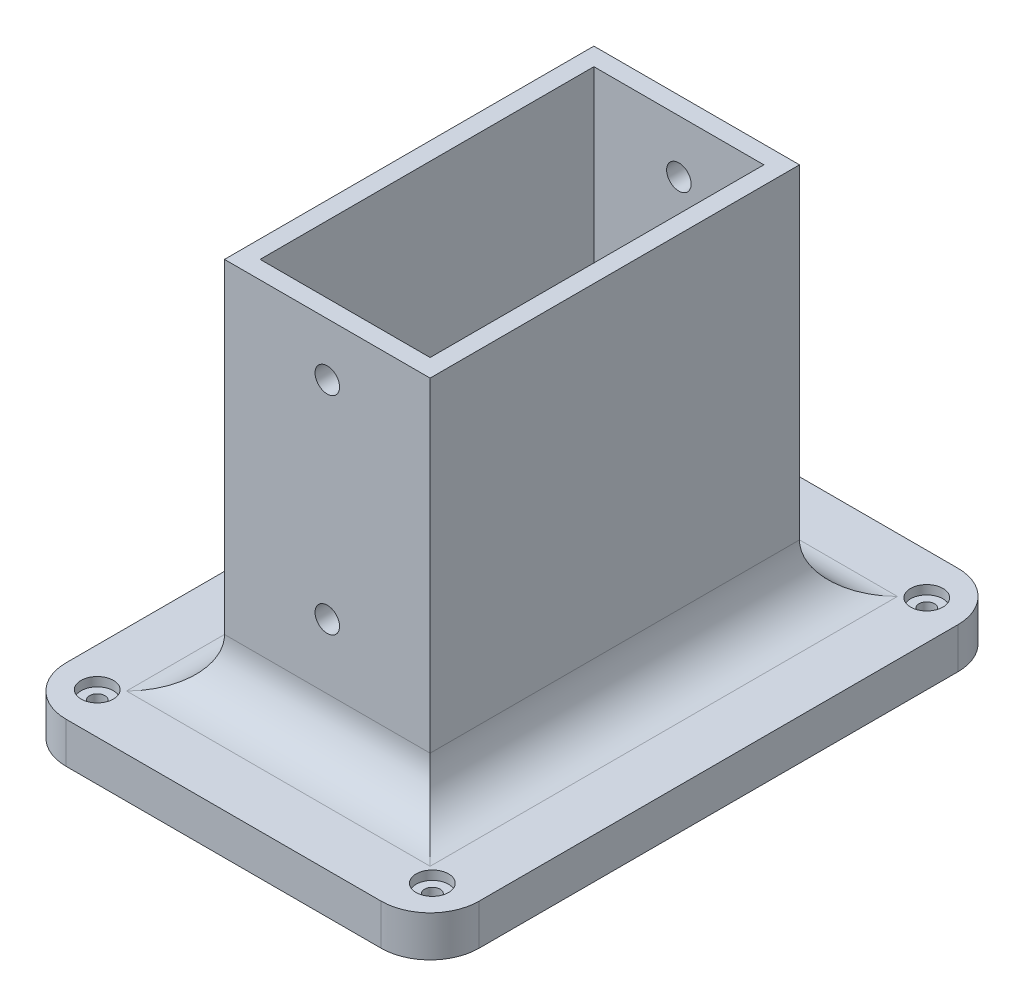
from build123d import *

# Parameters (mm, degrees)
SKETCH1_W                                     = 50.386
SKETCH1_H                                     = 90.518
SKETCH1_W_2                                   = 40.386
SKETCH1_H_2                                   = 80.518
BOSS_EXTRUDE1_DEPTH                           = 101.6
SKETCH2_W                                     = 101.186
SKETCH2_H                                     = 141.318
BOSS_EXTRUDE2_DEPTH                           = 10
FILLET1_R                                     = 12
CBORE_FOR_6_BINDING_HEAD_MACHINE_SC_2_R       = 1.89865
CBORE_FOR_6_BINDING_HEAD_MACHINE_SCREW2_DEPTH = 10
CBORE_START                                   = 7.7902
CBORE_FOR_6_BINDING_HEAD_MACHINE_SC_3_O_R     = 3.96875
CBORE_FOR_6_BINDING_HEAD_MACHINE_SC_3_O_R_2   = 1.89865
CBORE_FOR_6_BINDING_HEAD_MACHINE_SC_3_DEPTH   = 2.2098
FILLET2_R                                     = 12
SKETCH9_R                                     = 3
CUT_EXTRUDE1_DEPTH                            = 163.231915396
CUT_EXTRUDE2_REACH                            = 135.697
SKETCH10_W                                    = 41.656
SKETCH10_H                                    = 81.788
SKETCH10_W_2                                  = 40.386
SKETCH10_H_2                                  = 80.518
CUT_EXTRUDE2_DIRECTION_2_DEPTH                = 134.697067769


# Read off the part's stored shape, not the designer's step: CBORE for #6 Binding Head Machine Screw2
with BuildPart() as part:
    # Sketch1 → Boss-Extrude1 (new body)
    with BuildSketch(Plane(origin=(0, 0, 0), x_dir=(1, 0, 0), z_dir=(0, 1, 0))):
        Rectangle(SKETCH1_W, SKETCH1_H)
        Rectangle(SKETCH1_W_2, SKETCH1_H_2, mode=Mode.SUBTRACT)
    extrude(amount=BOSS_EXTRUDE1_DEPTH)

    # Sketch2 → Boss-Extrude2 (add)
    with BuildSketch(Plane(origin=(0, 0, 0), x_dir=(1, 0, 0), z_dir=(0, 1, 0))):
        Rectangle(SKETCH2_W, SKETCH2_H)
    extrude(amount=BOSS_EXTRUDE2_DEPTH)

    # Fillet1
    fillet1_edges = [part.edges().sort_by_distance(p)[0] for p in [
        (0, 10, -45.259),
        (25.193, 10, 0),
        (0, 10, 45.259),
        (-25.193, 10, 0),
    ]]
    fillet(fillet1_edges, radius=FILLET1_R)

    # CBORE for _6 Binding Head Machine Sc 2 → CBORE for #6 Binding Head Machine Screw2 (cut)
    with BuildSketch(Plane(origin=(0, 0, 0), x_dir=(1, 0, 0), z_dir=(0, 1, 0))):
        with Locations((41.060456563, -60.576250035)):
            Circle(CBORE_FOR_6_BINDING_HEAD_MACHINE_SC_2_R)
        with Locations((-41.060456563, 60.576250035)):
            Circle(CBORE_FOR_6_BINDING_HEAD_MACHINE_SC_2_R)
        with Locations((-41.060456563, -60.576250035)):
            Circle(CBORE_FOR_6_BINDING_HEAD_MACHINE_SC_2_R)
        with Locations((41.060456563, 60.576250035)):
            Circle(CBORE_FOR_6_BINDING_HEAD_MACHINE_SC_2_R)
        Circle(CBORE_FOR_6_BINDING_HEAD_MACHINE_SC_2_R)
    extrude(amount=CBORE_FOR_6_BINDING_HEAD_MACHINE_SCREW2_DEPTH, mode=Mode.SUBTRACT)

    # CBORE for _6 Binding Head Machine Sc 3 o → CBORE for _6 Binding Head Machine Sc 3 (cut)
    # profile 1 of 5: a face of its own
    with BuildSketch(Plane(origin=(0, 0, 0), x_dir=(1, 0, 0), z_dir=(0, 1, 0)).offset(CBORE_START)):
        with Locations((41.060456563, -60.576250035)):
            Circle(CBORE_FOR_6_BINDING_HEAD_MACHINE_SC_3_O_R)
        with Locations((41.060456563, -60.576250035)):
            Circle(CBORE_FOR_6_BINDING_HEAD_MACHINE_SC_3_O_R_2, mode=Mode.SUBTRACT)
    # profile 2 of 5: a face of its own
    with BuildSketch(Plane(origin=(0, 0, 0), x_dir=(1, 0, 0), z_dir=(0, 1, 0)).offset(CBORE_START)):
        with Locations((-41.060456563, 60.576250035)):
            Circle(CBORE_FOR_6_BINDING_HEAD_MACHINE_SC_3_O_R)
        with Locations((-41.060456563, 60.576250035)):
            Circle(CBORE_FOR_6_BINDING_HEAD_MACHINE_SC_3_O_R_2, mode=Mode.SUBTRACT)
    # profile 3 of 5: a face of its own
    with BuildSketch(Plane(origin=(0, 0, 0), x_dir=(1, 0, 0), z_dir=(0, 1, 0)).offset(CBORE_START)):
        with Locations((-41.060456563, -60.576250035)):
            Circle(CBORE_FOR_6_BINDING_HEAD_MACHINE_SC_3_O_R)
        with Locations((-41.060456563, -60.576250035)):
            Circle(CBORE_FOR_6_BINDING_HEAD_MACHINE_SC_3_O_R_2, mode=Mode.SUBTRACT)
    # profile 4 of 5: a face of its own
    with BuildSketch(Plane(origin=(0, 0, 0), x_dir=(1, 0, 0), z_dir=(0, 1, 0)).offset(CBORE_START)):
        with Locations((41.060456563, 60.576250035)):
            Circle(CBORE_FOR_6_BINDING_HEAD_MACHINE_SC_3_O_R)
        with Locations((41.060456563, 60.576250035)):
            Circle(CBORE_FOR_6_BINDING_HEAD_MACHINE_SC_3_O_R_2, mode=Mode.SUBTRACT)
    # profile 5 of 5: a face of its own
    with BuildSketch(Plane(origin=(0, 0, 0), x_dir=(1, 0, 0), z_dir=(0, 1, 0)).offset(CBORE_START)):
        Circle(CBORE_FOR_6_BINDING_HEAD_MACHINE_SC_3_O_R)
        Circle(CBORE_FOR_6_BINDING_HEAD_MACHINE_SC_3_O_R_2, mode=Mode.SUBTRACT)
    extrude(amount=CBORE_FOR_6_BINDING_HEAD_MACHINE_SC_3_DEPTH, mode=Mode.SUBTRACT)

    # Fillet2
    fillet2_edges = [part.edges().sort_by_distance(p)[0] for p in [
        (50.593, 5, 70.659),
        (50.593, 5, -70.659),
        (-50.593, 5, -70.659),
        (-50.593, 5, 70.659),
    ]]
    fillet(fillet2_edges, radius=FILLET2_R)

    # Sketch9 → Cut-Extrude1 (cut, through all)
    with BuildSketch(Plane.XY.offset(45.259)):
        with Locations((0, 88.608727906)):
            Circle(SKETCH9_R)
        with Locations((0, 37.808727906)):
            Circle(SKETCH9_R)
    extrude(amount=-CUT_EXTRUDE1_DEPTH, mode=Mode.SUBTRACT)

    # Cut-Extrude2: up to this face of the body (flat: up to its plane)
    cut_extrude2_end = Plane(part.part.faces().sort_by_distance((0, 10, -39.358212715))[0])
    # Sketch10 → Cut-Extrude2 (cut, up to the picked face)
    with BuildSketch(Plane(origin=(0, 101.6, 0), x_dir=(1, 0, 0), z_dir=(0, 1, 0)), mode=Mode.PRIVATE) as cut_extrude2_sk1:
        Rectangle(SKETCH10_W, SKETCH10_H)
        Rectangle(SKETCH10_W_2, SKETCH10_H_2, mode=Mode.SUBTRACT)
    cut_extrude2_tool1 = split(extrude(cut_extrude2_sk1.sketch, amount=-CUT_EXTRUDE2_REACH, mode=Mode.PRIVATE), bisect_by=cut_extrude2_end, keep=Keep.BOTH, mode=Mode.PRIVATE)
    add(cut_extrude2_tool1.solids().sort_by(Axis((20.736215, 101.6, 0), (0, -1, 0)))[0], mode=Mode.SUBTRACT)

    # Sketch10 → Cut-Extrude2 direction 2 (cut)
    with BuildSketch(Plane(origin=(0, 101.6, 0), x_dir=(1, 0, 0), z_dir=(0, 1, 0))):
        Rectangle(SKETCH10_W, SKETCH10_H)
        Rectangle(SKETCH10_W_2, SKETCH10_H_2, mode=Mode.SUBTRACT)
    extrude(amount=CUT_EXTRUDE2_DIRECTION_2_DEPTH, mode=Mode.SUBTRACT)


solid = part.part
